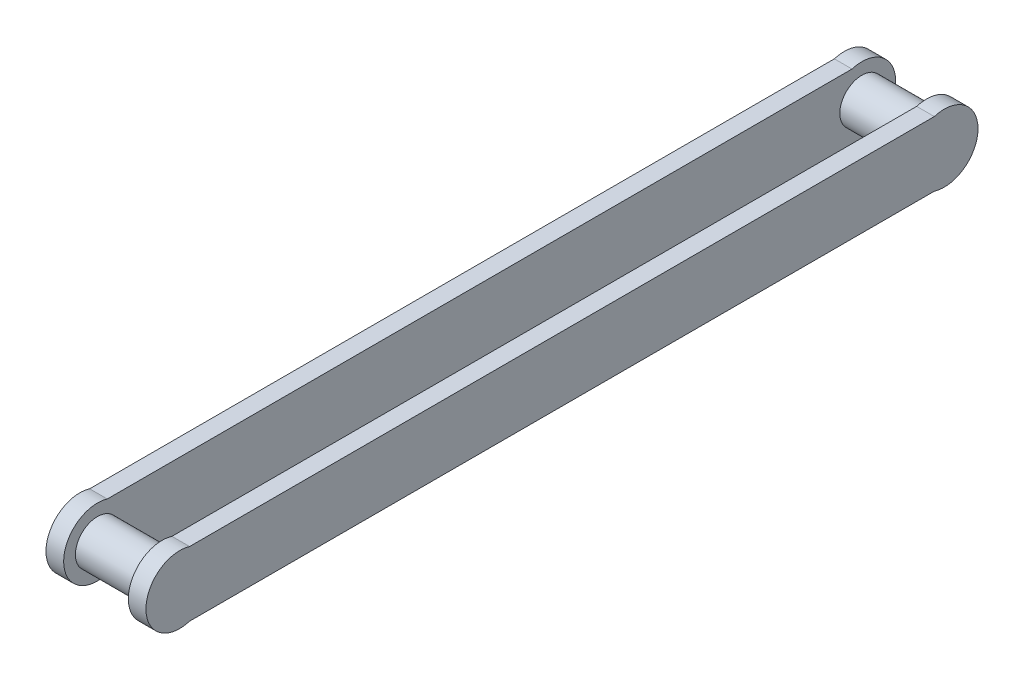
from build123d import *

# Parameters (mm, degrees)
SKETCH1_R             = 3.75
BOSS_EXTRUDE1_DEPTH   = 5.5
BOSS_EXTRUDE1_2_DEPTH = 5.5
BOSS_EXTRUDE3_DEPTH   = 3


with BuildPart() as part:
    # Sketch1 → Boss-Extrude1 (new body)
    with BuildSketch(Plane(origin=(0, 0, 0), x_dir=(0, 0, -1), z_dir=(1, 0, 0))):
        with Locations((-89.17195507, -2.222841681)):
            Circle(SKETCH1_R)
    boss_extrude1 = extrude(amount=BOSS_EXTRUDE1_DEPTH)



with BuildPart() as body_2:
    # Sketch1 → Boss-Extrude1 2 (new body)
    with BuildSketch(Plane(origin=(0, 0, 0), x_dir=(0, 0, -1), z_dir=(1, 0, 0))):
        with Locations((40.82804493, -2.222841681)):
            Circle(SKETCH1_R)
    boss_extrude1_2 = extrude(amount=BOSS_EXTRUDE1_2_DEPTH)


with BuildPart() as part_1:
    add(part.part)

    add(body_2.part)  # Boss-Extrude3 merges body 2
    # Sketch1<4> → Boss-Extrude3 (add)
    with BuildSketch(Plane(origin=(0, 0, 0), x_dir=(0, 0, -1), z_dir=(1, 0, 0))):
        with BuildLine():
            ThreePointArc((-87.494904087, 3.277158319), (-94.92195507, -2.222841681), (-87.494904087, -7.722841681))
            Line((-87.494904087, -7.722841681), (39.150993947, -7.722841681))
            ThreePointArc((39.150993947, -7.722841681), (46.57804493, -2.222841681), (39.150993947, 3.277158319))
            Line((39.150993947, 3.277158319), (-87.494904087, 3.277158319))
        make_face()
    boss_extrude3 = extrude(amount=-BOSS_EXTRUDE3_DEPTH)

    # Mirror1: Boss-Extrude1, Boss-Extrude1 2, Boss-Extrude3 across plane
    add(boss_extrude1.mirror(Plane(origin=(5.5, 0, 0), x_dir=(0, 0, 1), z_dir=(1, 0, 0))))
    add(boss_extrude1_2.mirror(Plane(origin=(5.5, 0, 0), x_dir=(0, 0, 1), z_dir=(1, 0, 0))))
    add(boss_extrude3.mirror(Plane(origin=(5.5, 0, 0), x_dir=(0, 0, 1), z_dir=(1, 0, 0))))


solid = part_1.part
